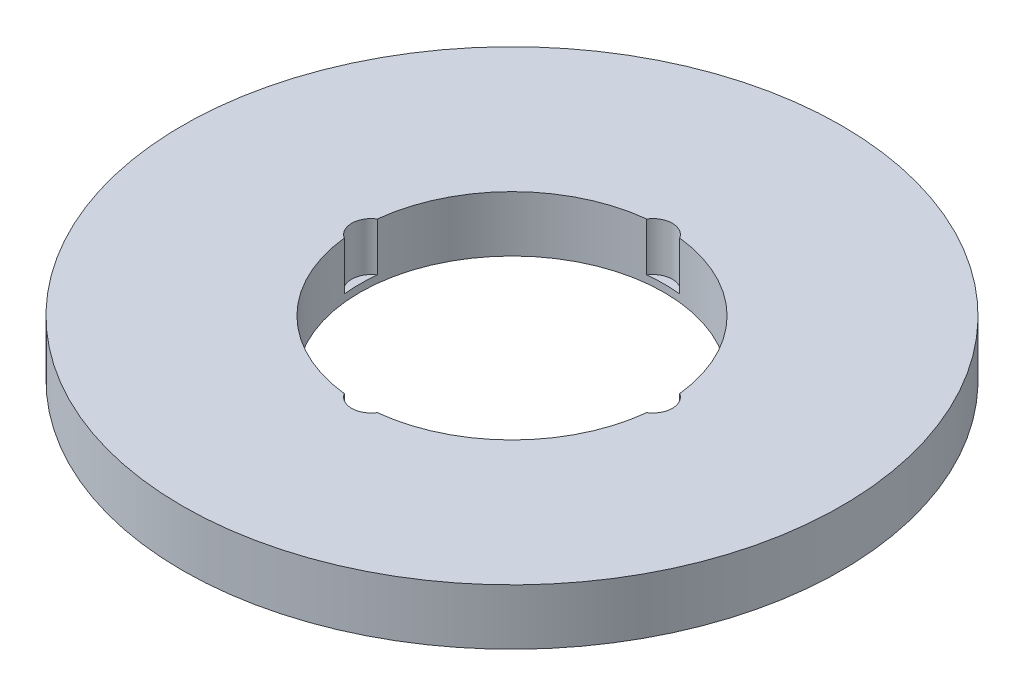
from build123d import *

# Parameters (mm, degrees)
SKETCH1_R           = 65
BOSS_EXTRUDE1_DEPTH = 11
SKETCH2_R           = 30
CUT_EXTRUDE1_DEPTH  = 93.579695398
SKETCH3_R           = 3.84724295
CUT_EXTRUDE2_DEPTH  = 9.559621371
CIRPATTERN1_COUNT   = 4


with BuildPart() as part:
    # Sketch1 → Boss-Extrude1 (new body)
    with BuildSketch(Plane(origin=(0, 0, 0), x_dir=(1, 0, 0), z_dir=(0, 1, 0))):
        Circle(SKETCH1_R)
    extrude(amount=BOSS_EXTRUDE1_DEPTH)

    # Sketch2 → Cut-Extrude1 (cut, through all)
    with BuildSketch(Plane(origin=(0, 0, 0), x_dir=(1, 0, 0), z_dir=(0, 1, 0))):
        Circle(SKETCH2_R)
    extrude(amount=CUT_EXTRUDE1_DEPTH, mode=Mode.SUBTRACT)

    # Sketch3 → Cut-Extrude2 (cut)
    with BuildSketch(Plane(origin=(0, 11, 0), x_dir=(1, 0, 0), z_dir=(0, 1, 0))):
        with Locations((-27.77276409, 0)):
            Circle(SKETCH3_R)
    cut_extrude2 = extrude(amount=-CUT_EXTRUDE2_DEPTH, mode=Mode.SUBTRACT)

    # CirPattern1: Cut-Extrude2 ×4 about axis
    cirpattern1_axis = Axis((0, 0, 0), (0, 1, 0))
    for i in range(1, CIRPATTERN1_COUNT):
        add(cut_extrude2.rotate(cirpattern1_axis, i * 360 / CIRPATTERN1_COUNT), mode=Mode.SUBTRACT)


solid = part.part
